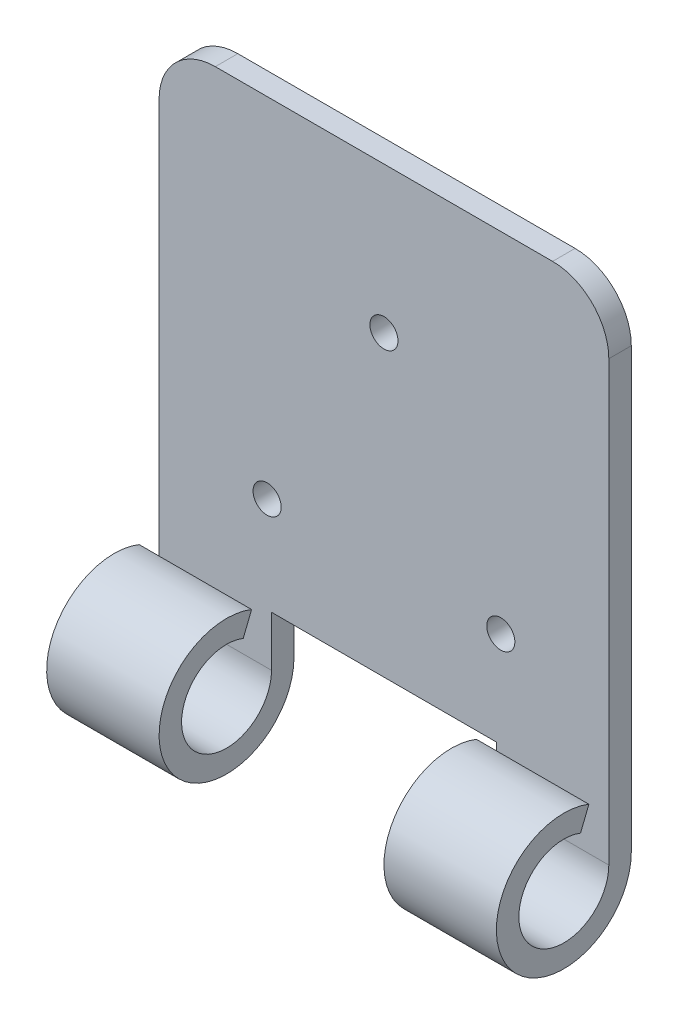
from build123d import *

# Parameters (mm, degrees)
SKETCH1_W           = 40
SKETCH1_H           = 50
BOSS_EXTRUDE1_DEPTH = 2
FILLET1_R           = 5
SKETCH2_R           = 1.25
CUT_EXTRUDE1_DEPTH  = 3
SKETCH3_W           = 40
SKETCH3_H           = 6
CUT_EXTRUDE3_DEPTH  = 3
BOSS_EXTRUDE2_DEPTH = 10
BOSS_EXTRUDE3_START = 10
BOSS_EXTRUDE3_DEPTH = 10
SKETCH7_R           = 6
CUT_EXTRUDE4_DEPTH  = 20
FILLET2_START       = 10
FILLET2_DEPTH       = 20


with BuildPart() as part:
    # Sketch1 → Boss-Extrude1 (new body)
    with BuildSketch(Plane.XY):
        with Locations((20, 25)):
            Rectangle(SKETCH1_W, SKETCH1_H)
    extrude(amount=BOSS_EXTRUDE1_DEPTH)

    # Fillet1
    fillet1_edges = [part.edges().sort_by_distance(p)[0] for p in [
        (0, 50, 1),
        (40, 50, 1),
    ]]
    fillet(fillet1_edges, radius=FILLET1_R)

    # Sketch2 → Cut-Extrude1 (cut)
    with BuildSketch(Plane.XY.offset(2)):
        with Locations((30.392304845, 19)):
            Circle(SKETCH2_R)
        with Locations((9.607695155, 19)):
            Circle(SKETCH2_R)
        with BuildLine():
            ThreePointArc((21.25, 37), (20.883883476, 37.883883476), (20, 38.25))
            Line((20, 38.25), (20, 35.75))
            ThreePointArc((20, 35.75), (20.883883476, 36.116116524), (21.25, 37))
        make_face()
        with BuildLine():
            Line((20, 35.75), (20, 38.25))
            ThreePointArc((20, 38.25), (18.75, 37), (20, 35.75))
        make_face()
    extrude(amount=-CUT_EXTRUDE1_DEPTH, mode=Mode.SUBTRACT)

    # Sketch3 → Cut-Extrude3 (cut)
    with BuildSketch(Plane.XY.offset(2)):
        with Locations((20, 3)):
            Rectangle(SKETCH3_W, SKETCH3_H)
    extrude(amount=-CUT_EXTRUDE3_DEPTH, mode=Mode.SUBTRACT)

    # Sketch5 → Boss-Extrude2 (add)
    with BuildSketch(Plane.ZY):
        with BuildLine():
            Line((3.77260129, 11.571238192), (4.515067527, 9.714158794))
            ThreePointArc((4.515067527, 9.714158794), (8.242796258, 9.312078644), (10, 6))
            ThreePointArc((10, 6), (6, 2), (2, 6))
            Line((2, 6), (0, 6))
            ThreePointArc((0, 6), (6, 0), (12, 6))
            ThreePointArc((12, 6), (9.364194387, 10.968117966), (3.77260129, 11.571238192))
        make_face()
    extrude(amount=-BOSS_EXTRUDE2_DEPTH)

    # Sketch6 → Boss-Extrude3 (add)
    with BuildSketch(Plane(origin=(40, 0, -40), x_dir=(0, 0, 1), z_dir=(-1, 0, 0)).offset(BOSS_EXTRUDE3_START)):
        with BuildLine():
            Line((43.77260129, 11.571238192), (44.515067527, 9.714158794))
            ThreePointArc((44.515067527, 9.714158794), (48.242796258, 9.312078644), (50, 6))
            ThreePointArc((50, 6), (46, 2), (42, 6))
            Line((42, 6), (40, 6))
            ThreePointArc((40, 6), (46, 0), (52, 6))
            ThreePointArc((52, 6), (49.364194387, 10.968117966), (43.77260129, 11.571238192))
        make_face()
    extrude(amount=-BOSS_EXTRUDE3_DEPTH)

    # Sketch7 → Cut-Extrude4 (cut)
    with BuildSketch(Plane(origin=(10, 0, 0), x_dir=(0, 0, -1), z_dir=(1, 0, 0))):
        with Locations((-6, 6)):
            Circle(SKETCH7_R)
    extrude(amount=CUT_EXTRUDE4_DEPTH, mode=Mode.SUBTRACT)

    # Fillet2: read off the stored shape, not the designer's step
    # Fillet2 outline → Fillet2 (cut)
    with BuildSketch(Plane.YZ.offset(FILLET2_START)):
        with BuildLine():
            Line((6, 0), (11.138093031, 0))
            ThreePointArc((11.138093031, 0), (10.1268882, 0.667027959), (10.342050449, 1.85915493))
            ThreePointArc((10.342050449, 1.85915493), (8.361665681, 0.484337283), (6, 0))
        make_face()
    extrude(amount=FILLET2_DEPTH, mode=Mode.SUBTRACT)


solid = part.part
